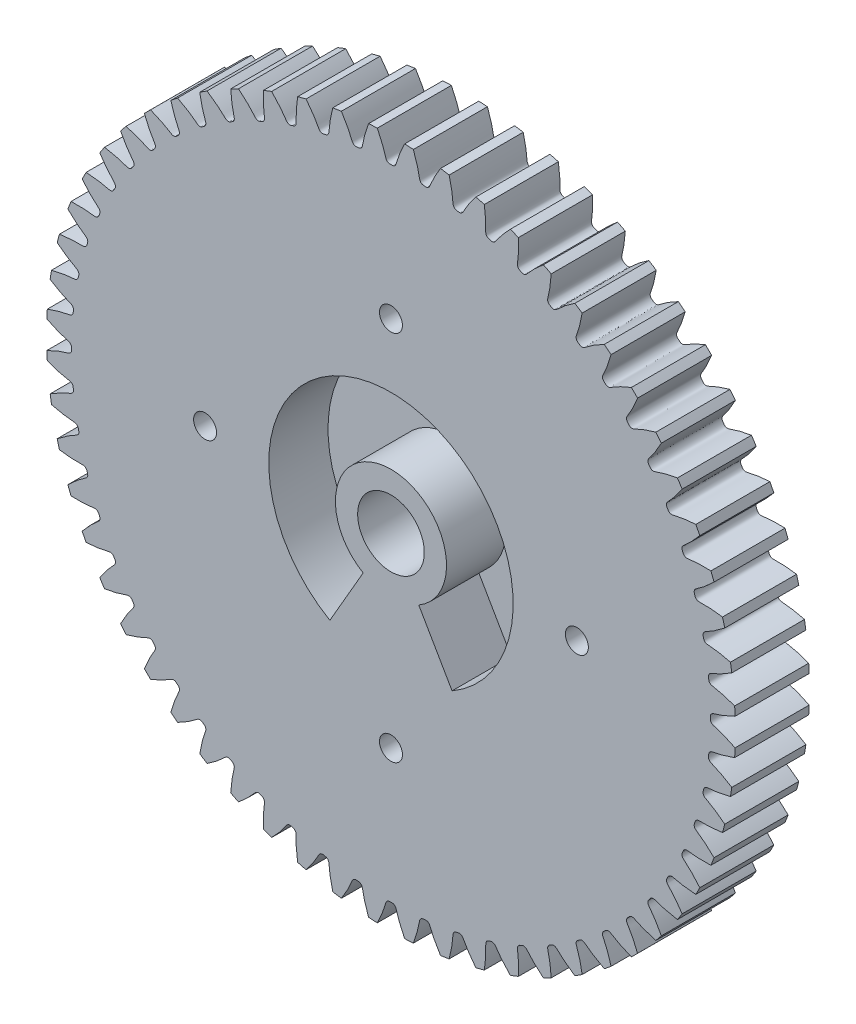
from build123d import *

# Parameters (mm, degrees)
SKETCHREVOLVESPURASSEMBLY01GEAR_W       = 10
SKETCHREVOLVESPURASSEMBLY01GEAR_H       = 46.499999302
TOOTHEXTRUDECUTSPURASSEMBLY01GEAR_DEPTH = 5
PATTERNSPURASSEMBLY01GEAR_COUNT         = 60
SKETCH5_R                               = 4.5
CUT_EXTRUDE2_DEPTH                      = 18
SKETCH6_R                               = 1.55
CUT_EXTRUDE3_DEPTH                      = 10
CIRPATTERN2_COUNT                       = 4
CUT_EXTRUDE4_DEPTH                      = 8
SKETCH7_R                               = 3.5
CUT_EXTRUDE5_DEPTH                      = 3


with BuildPart() as part:
    # SketchRevolveSpurAssembly01Gear → SpurAssembly01Gear (revolve)
    with BuildSketch(Plane(origin=(0, 0, 0), x_dir=(0, 0, -1), z_dir=(1, 0, 0))):
        with Locations((0, 23.249999651)):
            Rectangle(SKETCHREVOLVESPURASSEMBLY01GEAR_W, SKETCHREVOLVESPURASSEMBLY01GEAR_H)
    revolve(axis=Axis((0, 0, 0), (0, 0, -1)))

    # SketchToothSpurAssembly01Gear → ToothExtrudeCutSpurAssembly01Gear (cut, symmetric)
    with BuildSketch(Plane.XY):
        with BuildLine():
            ThreePointArc((46.536941888, 1.882445097), (46.574999301, 0), (46.536941888, -1.882445097))
            add(Edge.make_bspline(
                [(46.536941888, -1.882445097), (46.410580772, -1.817790323), (46.222345848, -1.724049646), (45.97247157, -1.604862074), (45.79126821, -1.520902479), (45.613955508, -1.441140119), (45.440604048, -1.365477285), (45.271282713, -1.293815196), (45.106058665, -1.226054069), (44.944997361, -1.162093066), (44.788162422, -1.101830604), (44.635616032, -1.045163354), (44.487417476, -0.991989937), (44.343628263, -0.942197901), (44.204293895, -0.895710038), (44.06950835, -0.852320586), (43.939186277, -0.812273822), (43.755364294, -0.756463501), (43.591162201, -0.718537687), (43.456933301, -0.660411719), (43.396978032, -0.628409971), (43.333262239, -0.585604909), (43.264730377, -0.524892475), (43.194956481, -0.436129591), (43.140009905, -0.315401482), (43.119097636, -0.163510161), (43.128214427, 0), (43.119097636, 0.163510161), (43.140009905, 0.315401482), (43.194956481, 0.436129591), (43.264730377, 0.524892475), (43.333262239, 0.585604909), (43.396978032, 0.628409971), (43.456933301, 0.660411719), (43.591162201, 0.718537687), (43.755364294, 0.756463501), (43.939186277, 0.812273822), (44.06950835, 0.852320586), (44.204293895, 0.895710038), (44.343628263, 0.942197901), (44.487417476, 0.991989937), (44.635616032, 1.045163354), (44.788162422, 1.101830604), (44.944997361, 1.162093066), (45.106058665, 1.226054069), (45.271282713, 1.293815196), (45.440604048, 1.365477285), (45.613955508, 1.441140119), (45.79126821, 1.520902479), (45.97247157, 1.604862074), (46.222345848, 1.724049646), (46.410580772, 1.817790323), (46.536941888, 1.882445097)],
                knots=[0, 0, 0, 0, 0.05176586, 0.076685537, 0.100963046, 0.124598386, 0.147591557, 0.16994256, 0.191651394, 0.21271806, 0.233142557, 0.252924885, 0.272065045, 0.290563036, 0.308418859, 0.325632513, 0.342203998, 0.358133315, 0.395728589, 0.403326908, 0.411414611, 0.420483419, 0.431260975, 0.444674611, 0.46138654, 0.478964563, 0.5, 0.521035437, 0.53861346, 0.555325389, 0.568739025, 0.579516581, 0.588585389, 0.596673092, 0.604271411, 0.641866685, 0.657796002, 0.674367487, 0.691581141, 0.709436964, 0.727934955, 0.747075115, 0.766857443, 0.78728194, 0.808348606, 0.83005744, 0.852408443, 0.875401614, 0.899036954, 0.923314463, 0.94823414, 1, 1, 1, 1], degree=3))
        make_face()
    toothextrudecutspurassembly01gear = extrude(amount=TOOTHEXTRUDECUTSPURASSEMBLY01GEAR_DEPTH, both=True, mode=Mode.SUBTRACT)

    # PatternSpurAssembly01Gear: ToothExtrudeCutSpurAssembly01Gear ×60 about axis
    patternspurassembly01gear_axis = Axis((0, 0, 5.5), (0, 0, -1))
    for i in range(1, PATTERNSPURASSEMBLY01GEAR_COUNT):
        add(toothextrudecutspurassembly01gear.rotate(patternspurassembly01gear_axis, i * 360 / PATTERNSPURASSEMBLY01GEAR_COUNT), mode=Mode.SUBTRACT)

    # Sketch5 → Cut-Extrude2 (cut)
    with BuildSketch(Plane(origin=(0, 0, -5), x_dir=(-1, 0, 0), z_dir=(0, 0, -1))):
        Circle(SKETCH5_R)
    extrude(amount=-CUT_EXTRUDE2_DEPTH, mode=Mode.SUBTRACT)

    # Sketch6 → Cut-Extrude3 (cut)
    with BuildSketch(Plane(origin=(0, 0, -5), x_dir=(-1, 0, 0), z_dir=(0, 0, -1))):
        with Locations((25.1, 0)):
            Circle(SKETCH6_R)
    cut_extrude3 = extrude(amount=-CUT_EXTRUDE3_DEPTH, mode=Mode.SUBTRACT)

    # CirPattern2: Cut-Extrude3 ×4 about axis
    cirpattern2_axis = Axis((0, 0, 5.5), (0, 0, -1))
    for i in range(1, CIRPATTERN2_COUNT):
        add(cut_extrude3.rotate(cirpattern2_axis, i * 360 / CIRPATTERN2_COUNT), mode=Mode.SUBTRACT)

    # Sketch4 → Cut-Extrude4 (cut)
    with BuildSketch(Plane.XY.offset(5)):
        with BuildLine():
            Line((-3.75, -6.495190528), (-8.25, -14.289419162))
            ThreePointArc((-8.25, -14.289419162), (0, 16.5), (8.25, -14.289419162))
            Line((8.25, -14.289419162), (3.75, -6.495190528))
            ThreePointArc((3.75, -6.495190528), (0, 7.5), (-3.75, -6.495190528))
        make_face()
    extrude(amount=-CUT_EXTRUDE4_DEPTH, mode=Mode.SUBTRACT)

    # Sketch7 → Cut-Extrude5 (cut)
    with BuildSketch(Plane(origin=(0, 0, -5), x_dir=(-1, 0, 0), z_dir=(0, 0, -1))):
        with Locations((-25.1, 0)):
            Circle(SKETCH7_R)
        with Locations((0, 25.1)):
            Circle(SKETCH7_R)
        with Locations((25.1, 0)):
            Circle(SKETCH7_R)
        with Locations((0, -25.1)):
            Circle(SKETCH7_R)
    extrude(amount=-CUT_EXTRUDE5_DEPTH, mode=Mode.SUBTRACT)


solid = part.part
